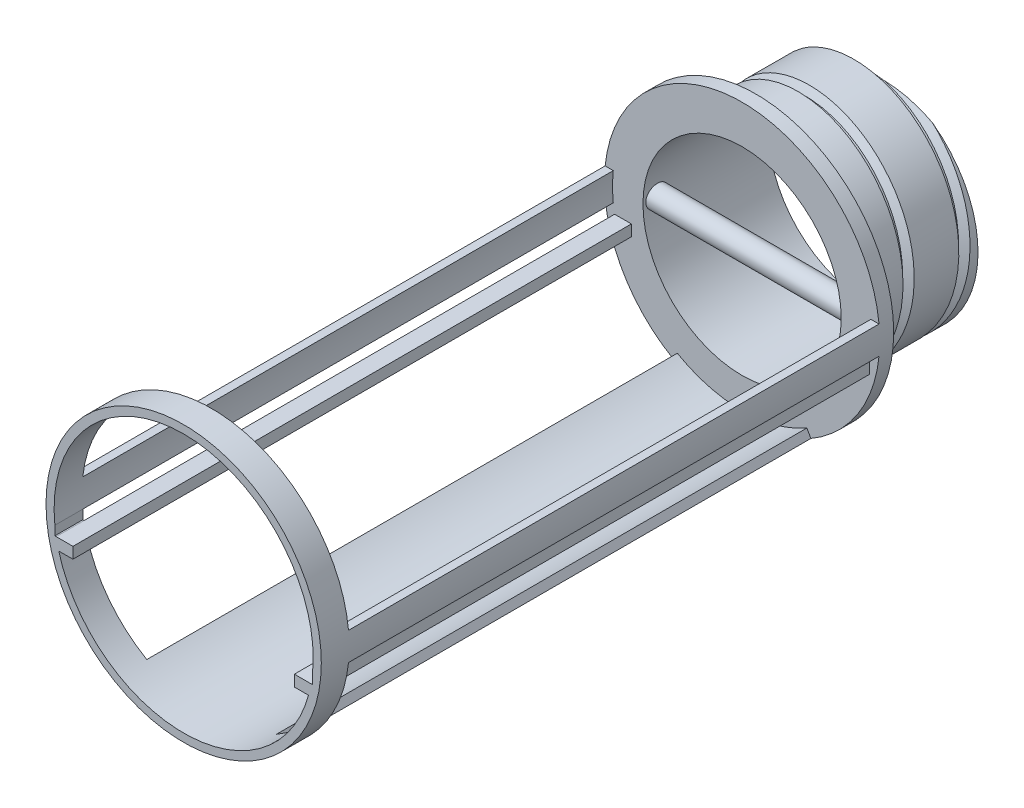
from build123d import *

# Parameters (mm, degrees)
SKETCH1_R                             = 19.75
SKETCH1_R_2                           = 17.75
BOSS_EXTRUDE1_DEPTH                   = 20
SKETCH2_R                             = 24.65
SKETCH2_R_2                           = 17.75
BOSS_EXTRUDE2_DEPTH                   = 2.5
SKETCH15_R                            = 24.65
SKETCH15_R_2                          = 23.2
BOSS_EXTRUDE3_DEPTH                   = 100
CUT_EXTRUDE2_START                    = -5
CUT_EXTRUDE2_DEPTH                    = 95
BOSS_EXTRUDE5_DEPTH                   = 100
CUT_EXTRUDE5_START                    = -5
CUT_EXTRUDE5_DEPTH                    = 6
BOSS_EXTRUDE17_REACH                  = 129.364
BOSS_EXTRUDE17_END_RADIUS             = 17.75
SKETCH25_R                            = 2
BOSS_EXTRUDE17_DIRECTION_2_REACH      = 129.364
BOSS_EXTRUDE17_DIRECTION_2_END_RADIUS = 17.75
SKETCH20_W                            = 3
SKETCH20_H                            = 2
BOSS_EXTRUDE20_DEPTH                  = 100
CUT_SWEEP1_PITCH                      = 10
CUT_SWEEP1_FROM                       = 0


with BuildPart() as part:
    # Sketch1 → Boss-Extrude1 (new body)
    with BuildSketch(Plane.XY):
        Circle(SKETCH1_R)
        Circle(SKETCH1_R_2, mode=Mode.SUBTRACT)
    extrude(amount=BOSS_EXTRUDE1_DEPTH)



with BuildPart() as body_2:
    # Sketch2 → Boss-Extrude2 (new body)
    with BuildSketch(Plane.XY.offset(20)):
        Circle(SKETCH2_R)
        Circle(SKETCH2_R_2, mode=Mode.SUBTRACT)
    extrude(amount=BOSS_EXTRUDE2_DEPTH)

    # Sketch15 → Boss-Extrude3 (add)
    with BuildSketch(Plane.XY.offset(22.5)):
        Circle(SKETCH15_R)
        Circle(SKETCH15_R_2, mode=Mode.SUBTRACT)
    extrude(amount=BOSS_EXTRUDE3_DEPTH)

    # Sketch16 → Cut-Extrude2 (cut)
    with BuildSketch(Plane.XY.offset(122.5).offset(CUT_EXTRUDE2_START)):
        with BuildLine():
            Line((-24.522897463, -2.5), (-23.064908411, -2.5))
            ThreePointArc((-23.064908411, -2.5), (0, -23.2), (23.064908411, -2.5))
            Line((23.064908411, -2.5), (24.522897463, -2.5))
            ThreePointArc((24.522897463, -2.5), (0, -24.65), (-24.522897463, -2.5))
        make_face()
        with BuildLine():
            Line((-24.522897463, 2.5), (-23.064908411, 2.5))
            ThreePointArc((-23.064908411, 2.5), (0, 23.2), (23.064908411, 2.5))
            Line((23.064908411, 2.5), (24.522897463, 2.5))
            ThreePointArc((24.522897463, 2.5), (0, 24.65), (-24.522897463, 2.5))
        make_face()
    extrude(amount=-CUT_EXTRUDE2_DEPTH, mode=Mode.SUBTRACT)

    # Sketch19 → Boss-Extrude5 (add)
    with BuildSketch(Plane.XY.offset(122.5)):
        with BuildLine():
            Line((-12.325, -21.347526203), (-11.6, -20.091789368))
            ThreePointArc((-11.6, -20.091789368), (0, -23.2), (11.6, -20.091789368))
            Line((11.6, -20.091789368), (12.325, -21.347526203))
            ThreePointArc((12.325, -21.347526203), (0, -24.65), (-12.325, -21.347526203))
        make_face()
    extrude(amount=-BOSS_EXTRUDE5_DEPTH)

    # Cut-Extrude5: read off the stored shape, not the designer's step
    # Cut-Extrude5 outline → Cut-Extrude5 (cut)
    with BuildSketch(Plane.XY.offset(122.5).offset(CUT_EXTRUDE5_START)):
        with BuildLine():
            Line((22.82586746, -4.149671639), (23.064908411, -4.15))
            Line((23.064908411, -4.15), (23.064908411, -2.5))
            ThreePointArc((23.064908411, -2.5), (22.960208658, -3.326983374), (22.82586746, -4.149671639))
        make_face()
        with BuildLine():
            Line((-23.064908411, -4.15), (-22.82586746, -4.149671639))
            ThreePointArc((-22.82586746, -4.149671639), (-22.960208658, -3.326983374), (-23.064908411, -2.5))
            Line((-23.064908411, -2.5), (-23.064908411, -4.15))
        make_face()
    extrude(amount=CUT_EXTRUDE5_DEPTH, mode=Mode.SUBTRACT)


with BuildPart() as part_1:
    add(part.part)

    add(body_2.part)  # Boss-Extrude17 merges body 2
    # Boss-Extrude17: up to this cylinder (the profile starts inside it)
    boss_extrude17_end = Plane(origin=(0, 0, 20), z_dir=(0, 0, -1)) * Cylinder(BOSS_EXTRUDE17_END_RADIUS, 295.228, mode=Mode.PRIVATE)
    # Sketch25 → Boss-Extrude17 (add, up to the surface)
    with BuildSketch(Plane(origin=(0, 0, 0), x_dir=(0, 0, -1), z_dir=(1, 0, 0)), mode=Mode.PRIVATE) as boss_extrude17_sk1:
        with Locations(Location((-20, 0, 0), (0, 0, 180))):
            Circle(SKETCH25_R)
    boss_extrude17_tool1 = extrude(boss_extrude17_sk1.sketch, amount=BOSS_EXTRUDE17_REACH, mode=Mode.PRIVATE) & boss_extrude17_end
    add(boss_extrude17_tool1.solids().sort_by_distance((0, 0, 20))[0])

    # Boss-Extrude17 direction 2: up to this cylinder (the profile starts inside it)
    boss_extrude17_direction_2_end = Plane(origin=(0, 0, 20), z_dir=(0, 0, -1)) * Cylinder(BOSS_EXTRUDE17_DIRECTION_2_END_RADIUS, 295.228, mode=Mode.PRIVATE)
    # Sketch25 → Boss-Extrude17 direction 2 (add, up to the surface)
    with BuildSketch(Plane(origin=(0, 0, 0), x_dir=(0, 0, -1), z_dir=(1, 0, 0)), mode=Mode.PRIVATE) as boss_extrude17_direction_2_sk1:
        with Locations(Location((-20, 0, 0), (0, 0, 180))):
            Circle(SKETCH25_R)
    boss_extrude17_direction_2_tool1 = extrude(boss_extrude17_direction_2_sk1.sketch, amount=-BOSS_EXTRUDE17_DIRECTION_2_REACH, mode=Mode.PRIVATE) & boss_extrude17_direction_2_end
    add(boss_extrude17_direction_2_tool1.solids().sort_by_distance((0, 0, 20))[0])

    # Sketch20 → Boss-Extrude20 (add)
    with BuildSketch(Plane.XY.offset(122.5)):
        with Locations((21.32586746, -5.149671639)):
            Rectangle(SKETCH20_W, SKETCH20_H)
        Polygon((-22.82586746, -4.149671639), (-19.82586746, -4.149671639), (-19.82586746, -6.149671639), (-22.370103682, -6.149671639), (-22.82586746, -6.149671639), align=None)
    extrude(amount=-BOSS_EXTRUDE20_DEPTH)

    # Cut-Sweep1: arcs per turn and ends read off the stored shape
    # Cut-Sweep1: the profile of Sketch32 profile screwed along a left-hand helix through 3.5 turns, 16 arcs to a turn; built about Z, then put on its axis
    cut_sweep1_z = Axis((0, 0, 0), (0, 0, 1))
    cut_sweep1_corners = [(19.7503, 0, -11.000173205), (19.7503, 0, -8.999826795), (18.450961894, 0, -9.75), (18.450961894, 0, -10.25)]
    with BuildLine(mode=Mode.PRIVATE) as cut_sweep1_profile:
        Line(cut_sweep1_corners[0], cut_sweep1_corners[1])
        Line(cut_sweep1_corners[1], cut_sweep1_corners[2])
        Line(cut_sweep1_corners[2], cut_sweep1_corners[3])
        Line(cut_sweep1_corners[3], cut_sweep1_corners[0])
    cut_sweep1_cap = Face(cut_sweep1_profile.wire())
    cut_sweep1_turn_angles = [0, -11.25, -22.5, -33.75, -45, -56.25, -67.5, -78.75, -90, -101.25, -112.5, -123.75, -135, -146.25, -157.5, -168.75, -180, -191.25, -202.5, -213.75, -225, -236.25, -247.5, -258.75, -270, -281.25, -292.5, -303.75, -315, -326.25, -337.5, -348.75, -360]
    cut_sweep1_turn_weights = [1, 0.9807852804032304, 1, 0.9807852804032304, 1, 0.9807852804032304, 1, 0.9807852804032304, 1, 0.9807852804032304, 1, 0.9807852804032304, 1, 0.9807852804032304, 1, 0.9807852804032304, 1, 0.9807852804032304, 1, 0.9807852804032304, 1, 0.9807852804032304, 1, 0.9807852804032304, 1, 0.9807852804032304, 1, 0.9807852804032304, 1, 0.9807852804032304, 1, 0.9807852804032304, 1]
    cut_sweep1_turn_rails = [Edge.make_bspline([Vector(p[0], p[1], 0).rotate(cut_sweep1_z, cut_sweep1_turn_angles[k]) / cut_sweep1_turn_weights[k] + Vector(0, 0, p[2] + -CUT_SWEEP1_PITCH * cut_sweep1_turn_angles[k] / 360) for k in range(33)], [0, 0, 0, 1, 1, 2, 2, 3, 3, 4, 4, 5, 5, 6, 6, 7, 7, 8, 8, 9, 9, 10, 10, 11, 11, 12, 12, 13, 13, 14, 14, 15, 15, 16, 16, 16], 2, cut_sweep1_turn_weights) for p in cut_sweep1_corners]
    cut_sweep1_turn_sides = [Face.make_surface_from_curves(cut_sweep1_turn_rails[p[0]], cut_sweep1_turn_rails[p[1]]) for p in [(0, 1), (1, 2), (2, 3), (3, 0)]]
    cut_sweep1_last_angles = [-1080, -1091.25, -1102.5, -1113.75, -1125, -1136.25, -1147.5, -1158.75, -1170, -1181.25, -1192.5, -1203.75, -1215, -1226.25, -1237.5, -1248.75, -1260]
    cut_sweep1_last_weights = [1, 0.9807852804032304, 1, 0.9807852804032304, 1, 0.9807852804032304, 1, 0.9807852804032304, 1, 0.9807852804032304, 1, 0.9807852804032304, 1, 0.9807852804032304, 1, 0.9807852804032304, 1]
    cut_sweep1_last_rails = [Edge.make_bspline([Vector(p[0], p[1], 0).rotate(cut_sweep1_z, cut_sweep1_last_angles[k]) / cut_sweep1_last_weights[k] + Vector(0, 0, p[2] + -CUT_SWEEP1_PITCH * cut_sweep1_last_angles[k] / 360) for k in range(17)], [0, 0, 0, 1, 1, 2, 2, 3, 3, 4, 4, 5, 5, 6, 6, 7, 7, 8, 8, 8], 2, cut_sweep1_last_weights) for p in cut_sweep1_corners]
    cut_sweep1_last_sides = [Face.make_surface_from_curves(cut_sweep1_last_rails[p[0]], cut_sweep1_last_rails[p[1]]) for p in [(0, 1), (1, 2), (2, 3), (3, 0)]]
    cut_sweep1 = Plane(origin=(0, 0, 20), x_dir=(0, 1, 0), z_dir=(0, 0, -1)) * split(Solid(Shell([*[p.moved(Location((0, 0, CUT_SWEEP1_PITCH * i))) for i in range(3) for p in cut_sweep1_turn_sides], *cut_sweep1_last_sides, cut_sweep1_cap, cut_sweep1_cap.rotate(cut_sweep1_z, -1260).moved(Location((0, 0, -CUT_SWEEP1_PITCH * -1260 / 360)))])), bisect_by=Plane.XY.offset(CUT_SWEEP1_FROM), keep=Keep.TOP, mode=Mode.PRIVATE)
    add(cut_sweep1, mode=Mode.SUBTRACT)


solid = part_1.part
